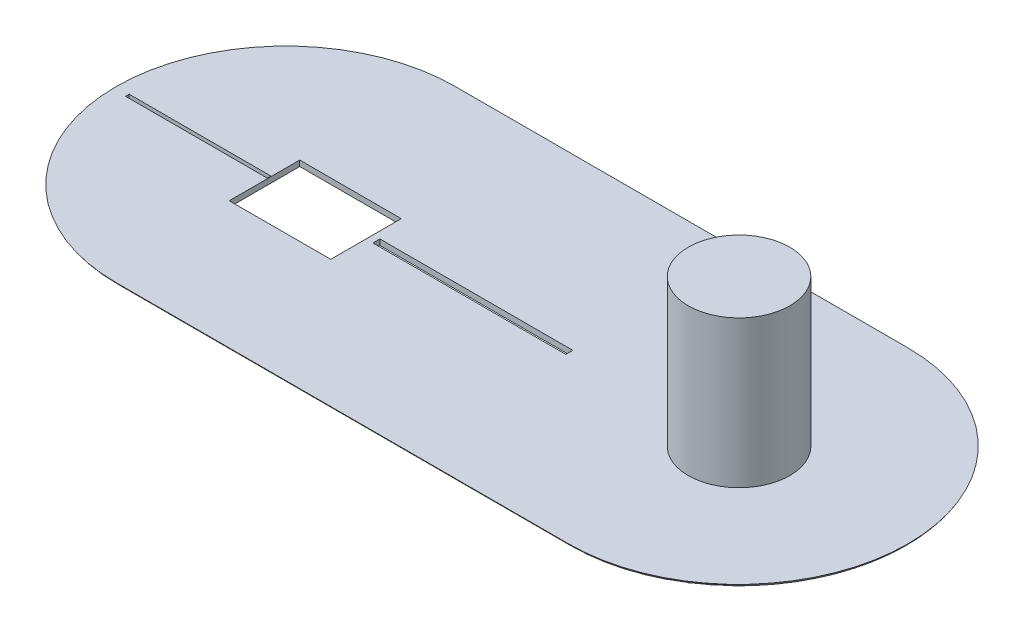
from build123d import *

# Parameters (mm, degrees)
BOSS_EXTRUDE4_DEPTH = 1.27
SKETCH11_R          = 11.402996403
BOSS_EXTRUDE6_DEPTH = 33.02
SKETCH12_W          = 22.792557874
SKETCH12_H          = 15.82816519
CUT_EXTRUDE4_DEPTH  = 12.7
FILLET1_R           = 2.54
SKETCH13_W          = 31.831001044
SKETCH13_H          = 0.811195954
SKETCH13_W_2        = 43.310342169
SKETCH13_H_2        = 1.569408792
CUT_EXTRUDE5_DEPTH  = 22.86


with BuildPart() as part:
    # Sketch2 → Boss-Extrude4 (new body)
    with BuildSketch(Plane(origin=(0, 0, 0), x_dir=(1, 0, 0), z_dir=(0, 1, 0))):
        with BuildLine():
            Line((-42.31395881, 38.1), (59.28604119, 38.1))
            ThreePointArc((59.28604119, 38.1), (97.38604119, 0), (59.28604119, -38.1))
            Line((59.28604119, -38.1), (-42.31395881, -38.1))
            ThreePointArc((-42.31395881, -38.1), (-80.41395881, 0), (-42.31395881, 38.1))
        make_face()
    extrude(amount=BOSS_EXTRUDE4_DEPTH)

    # Sketch11 → Boss-Extrude6 (add)
    with BuildSketch(Plane(origin=(0, 1.27, 0), x_dir=(1, 0, 0), z_dir=(0, 1, 0))):
        with Locations(Location((59.460873827, 0, 0), (0, 0, 270))):
            Circle(SKETCH11_R)
    extrude(amount=BOSS_EXTRUDE6_DEPTH)

    # Sketch12 → Cut-Extrude4 (cut)
    with BuildSketch(Plane(origin=(0, 1.27, 0), x_dir=(1, 0, 0), z_dir=(0, 1, 0))):
        with Locations((-34.122794633, -1.569408792)):
            Rectangle(SKETCH12_W, SKETCH12_H)
    extrude(amount=-CUT_EXTRUDE4_DEPTH, mode=Mode.SUBTRACT)

    # Fillet1
    # the kernel refuses this fillet: 2.54 mm, written as the material it takes off along each edge
    with BuildSketch(Plane(origin=(-42.31395881, 0, 0), x_dir=(0, 0, 1), z_dir=(1, 0, 0))) as fillet1_piece_1:
        with BuildLine():
            CenterArc((35.900295474, -2.54), FILLET1_R, 30, 60)
            Line((35.900295474, 0), (35.900295474, 0.0508))
            Line((35.900295474, 0.0508), (38.1, 0.0508))
            Line((38.1, 0.0508), (38.1508, 0))
            ThreePointArc((38.1508, 0), (38.1508, -0.635), (38.143994091, -1.2446))
            Line((38.143994091, -1.2446), (38.1, -1.27))
        make_face()
    revolve(axis=Axis((-42.31395881, 0, 0), (0, -1, 0)), revolution_arc=180, mode=Mode.SUBTRACT)
    with BuildSketch(Plane(origin=(59.28604119, 0, 38.1), x_dir=(0, 1, 0), z_dir=(-1, 0, 0))) as fillet1_piece_2:
        with BuildLine():
            CenterArc((2.54, 2.199704526), FILLET1_R, 180, 60)
            Line((0, 2.199704526), (-0.0508, 2.199704526))
            Line((-0.0508, 2.199704526), (-0.0508, 0))
            Line((-0.0508, 0), (0, -0.0508))
            ThreePointArc((0, -0.0508), (0.635, -0.0508), (1.2446, -0.043994091))
            Line((1.2446, -0.043994091), (1.27, 0))
        make_face()
    extrude(amount=101.6, mode=Mode.SUBTRACT)
    with BuildSketch(Plane(origin=(59.28604119, 0, 0), x_dir=(0, 0, -1), z_dir=(-1, 0, 0))) as fillet1_piece_3:
        with BuildLine():
            CenterArc((35.900295474, -2.54), FILLET1_R, 30, 60)
            Line((35.900295474, 0), (35.900295474, 0.0508))
            Line((35.900295474, 0.0508), (38.1, 0.0508))
            Line((38.1, 0.0508), (38.1508, 0))
            ThreePointArc((38.1508, 0), (38.1508, -0.635), (38.143994091, -1.2446))
            Line((38.143994091, -1.2446), (38.1, -1.27))
        make_face()
    revolve(axis=Axis((59.28604119, 0, 0), (0, -1, 0)), revolution_arc=180, mode=Mode.SUBTRACT)
    with BuildSketch(Plane(origin=(-42.31395881, 0, -38.1), x_dir=(0, 0, 1), z_dir=(1, 0, 0))) as fillet1_piece_4:
        with BuildLine():
            CenterArc((2.199704526, -2.54), FILLET1_R, 90, 60)
            Line((0, -1.27), (-0.043994091, -1.2446))
            ThreePointArc((-0.043994091, -1.2446), (-0.0508, -0.635), (-0.0508, 0))
            Line((-0.0508, 0), (0, 0.0508))
            Line((0, 0.0508), (2.199704526, 0.0508))
            Line((2.199704526, 0.0508), (2.199704526, 0))
        make_face()
    extrude(amount=101.6, mode=Mode.SUBTRACT)

    # Sketch13 → Cut-Extrude5 (cut)
    with BuildSketch(Plane.XZ):
        with Locations((-61.546134254, 0.405597977)):
            Rectangle(SKETCH13_W, SKETCH13_H)
        with Locations((0.488633532, 0.784704396)):
            Rectangle(SKETCH13_W_2, SKETCH13_H_2)
    extrude(amount=-CUT_EXTRUDE5_DEPTH, mode=Mode.SUBTRACT)


solid = part.part
